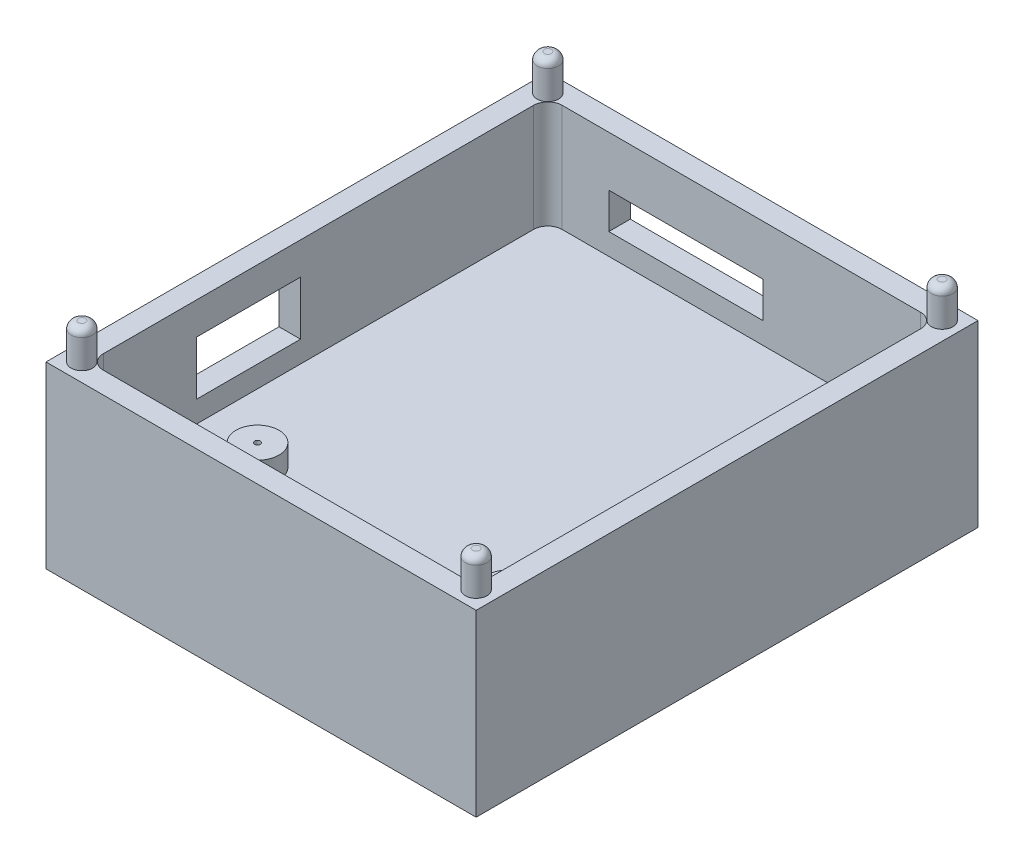
from build123d import *

# Parameters (mm, degrees)
SKETCH1_W           = 60
SKETCH1_H           = 70
BOSS_EXTRUDE1_DEPTH = 10
SKETCH2_W           = 60
SKETCH2_H           = 70
SKETCH2_W_2         = 54
SKETCH2_H_2         = 64
BOSS_EXTRUDE2_DEPTH = 15
SKETCH3_R           = 1.5
BOSS_EXTRUDE3_DEPTH = 5
SKETCH8_R           = 3
SKETCH8_R_2         = 0.4
BOSS_EXTRUDE4_DEPTH = 3
CUT_EXTRUDE1_START  = -4
SKETCH11_R          = 0.4
CUT_EXTRUDE1_DEPTH  = 4
SKETCH12_W          = 21.5
SKETCH12_H          = 5
CUT_EXTRUDE2_DEPTH  = 5
FILLET2_R           = 1
SKETCH18_R          = 1.25
CUT_EXTRUDE6_DEPTH  = 7
SKETCH20_W          = 14.5
SKETCH20_H          = 7.5
CUT_EXTRUDE7_DEPTH  = 7
FILLET3_R           = 2


with BuildPart() as part:
    # Sketch1 → Boss-Extrude1 (new body)
    with BuildSketch(Plane(origin=(0, 0, 0), x_dir=(1, 0, 0), z_dir=(0, 1, 0))):
        with Locations((4.122137405, -1.297709924)):
            Rectangle(SKETCH1_W, SKETCH1_H)
    extrude(amount=BOSS_EXTRUDE1_DEPTH)

    # Sketch2 → Boss-Extrude2 (add)
    with BuildSketch(Plane(origin=(0, 10, 0), x_dir=(1, 0, 0), z_dir=(0, 1, 0))):
        with Locations((4.122137405, -1.297709924)):
            Rectangle(SKETCH2_W, SKETCH2_H)
        with Locations((4.122137405, -1.297709924)):
            Rectangle(SKETCH2_W_2, SKETCH2_H_2, mode=Mode.SUBTRACT)
    extrude(amount=BOSS_EXTRUDE2_DEPTH)

    # Sketch3 → Boss-Extrude3 (add)
    with BuildSketch(Plane(origin=(0, 25, 0), x_dir=(1, 0, 0), z_dir=(0, 1, 0))):
        with Locations(Location((-23.377862595, 31.202290076, 0), (0, 0, 340.528779366))):
            Circle(SKETCH3_R)
        with Locations(Location((31.622137405, 31.202290076, 0), (0, 0, 199.471220634))):
            Circle(SKETCH3_R)
        with Locations(Location((31.622137405, -33.797709924, 0), (0, 0, 109.471220634))):
            Circle(SKETCH3_R)
        with Locations(Location((-23.377862595, -33.797709924, 0), (0, 0, 70.528779366))):
            Circle(SKETCH3_R)
    extrude(amount=BOSS_EXTRUDE3_DEPTH)

    # Sketch8 → Boss-Extrude4 (add)
    # profile 1 of 3: a face of its own
    with BuildSketch(Plane(origin=(0, 10, 0), x_dir=(1, 0, 0), z_dir=(0, 1, 0))):
        with Locations(Location((21.622137405, -19.297709924, 0), (0, 0, 270))):
            Circle(SKETCH8_R)
        with Locations(Location((21.622137405, -19.297709924, 0), (0, 0, 270))):
            Circle(SKETCH8_R_2, mode=Mode.SUBTRACT)
    # profile 2 of 3: a face of its own
    with BuildSketch(Plane(origin=(0, 10, 0), x_dir=(1, 0, 0), z_dir=(0, 1, 0))):
        with Locations(Location((-13.377862595, -19.297709924, 0), (0, 0, 270))):
            Circle(SKETCH8_R)
        with Locations(Location((-13.377862595, -19.297709924, 0), (0, 0, 270))):
            Circle(SKETCH8_R_2, mode=Mode.SUBTRACT)
    # profile 3 of 3: a face of its own
    with BuildSketch(Plane(origin=(0, 10, 0), x_dir=(1, 0, 0), z_dir=(0, 1, 0))):
        with Locations(Location((23.622137405, 25.702290076, 0), (0, 0, 270))):
            Circle(SKETCH8_R)
        with Locations(Location((23.622137405, 25.702290076, 0), (0, 0, 270))):
            Circle(SKETCH8_R_2, mode=Mode.SUBTRACT)
    extrude(amount=BOSS_EXTRUDE4_DEPTH)

    # Sketch11 → Cut-Extrude1 (cut)
    with BuildSketch(Plane(origin=(0, 10, 0), x_dir=(1, 0, 0), z_dir=(0, 1, 0)).offset(CUT_EXTRUDE1_START)):
        with Locations(Location((-13.377862595, -19.297709924, 0), (0, 0, 270))):
            Circle(SKETCH11_R)
        with Locations(Location((21.622137405, -19.297709924, 0), (0, 0, 270))):
            Circle(SKETCH11_R)
        with Locations(Location((23.622137405, 25.702290076, 0), (0, 0, 270))):
            Circle(SKETCH11_R)
    extrude(amount=CUT_EXTRUDE1_DEPTH, mode=Mode.SUBTRACT)

    # Sketch12 → Cut-Extrude2 (cut)
    with BuildSketch(Plane(origin=(0, 0, -33.702290076), x_dir=(-1, 0, 0), z_dir=(0, 0, -1))):
        with Locations((3.627862595, 15.5)):
            Rectangle(SKETCH12_W, SKETCH12_H)
    extrude(amount=-CUT_EXTRUDE2_DEPTH, mode=Mode.SUBTRACT)

    # Fillet2
    fillet2_edges = [part.edges().sort_by_distance(p)[0] for p in [
        (-24.792076158, 30, -31.702290076),
        (33.036350967, 30, -31.702290076),
        (32.122137405, 30, 35.211923486),
        (-23.877862595, 30, 35.211923486),
    ]]
    fillet(fillet2_edges, radius=FILLET2_R)

    # Sketch18 → Cut-Extrude6 (cut)
    with BuildSketch(Plane.XZ):
        with Locations(Location((4.122137405, 23.797709924, 0), (0, 0, 270))):
            Circle(SKETCH18_R)
        with Locations(Location((4.122137405, 1.297709924, 0), (0, 0, 270))):
            Circle(SKETCH18_R)
        with Locations(Location((4.122137405, -21.202290076, 0), (0, 0, 270))):
            Circle(SKETCH18_R)
    extrude(amount=-CUT_EXTRUDE6_DEPTH, mode=Mode.SUBTRACT)

    # Sketch20 → Cut-Extrude7 (cut)
    with BuildSketch(Plane.ZY.offset(25.877862595)):
        with Locations((11.047709924, 16.75)):
            Rectangle(SKETCH20_W, SKETCH20_H)
    extrude(amount=-CUT_EXTRUDE7_DEPTH, mode=Mode.SUBTRACT)

    # Fillet3
    # the kernel refuses this fillet: 2 mm, written as the material it adds along each edge
    with BuildSketch(Plane(origin=(-22.877862595, 5, -30.702290076), x_dir=(0, 0, 1), z_dir=(0, 1, 0)), Plane(origin=(31.122137405, 5, -30.702290076), x_dir=(-1, 0, 0), z_dir=(0, 1, 0))) as fillet3_piece_1:
        with BuildLine():
            CenterArc((FILLET3_R, FILLET3_R), FILLET3_R, 180, 90)
            Line((0, FILLET3_R), (0, 0))
            Line((0, 0), (FILLET3_R, 0))
        make_face()
    extrude(amount=20)
    with BuildSketch(Plane(origin=(-22.877862595, 5, 33.297709924), x_dir=(0, 0, -1), z_dir=(0, 1, 0)), Plane(origin=(31.122137405, 5, 33.297709924), x_dir=(-1, 0, 0), z_dir=(0, 1, 0))) as fillet3_piece_2:
        with BuildLine():
            CenterArc((FILLET3_R, -FILLET3_R), FILLET3_R, 90, 90)
            Line((0, -FILLET3_R), (0, 0))
            Line((0, 0), (FILLET3_R, 0))
        make_face()
    extrude(amount=20)


solid = part.part
